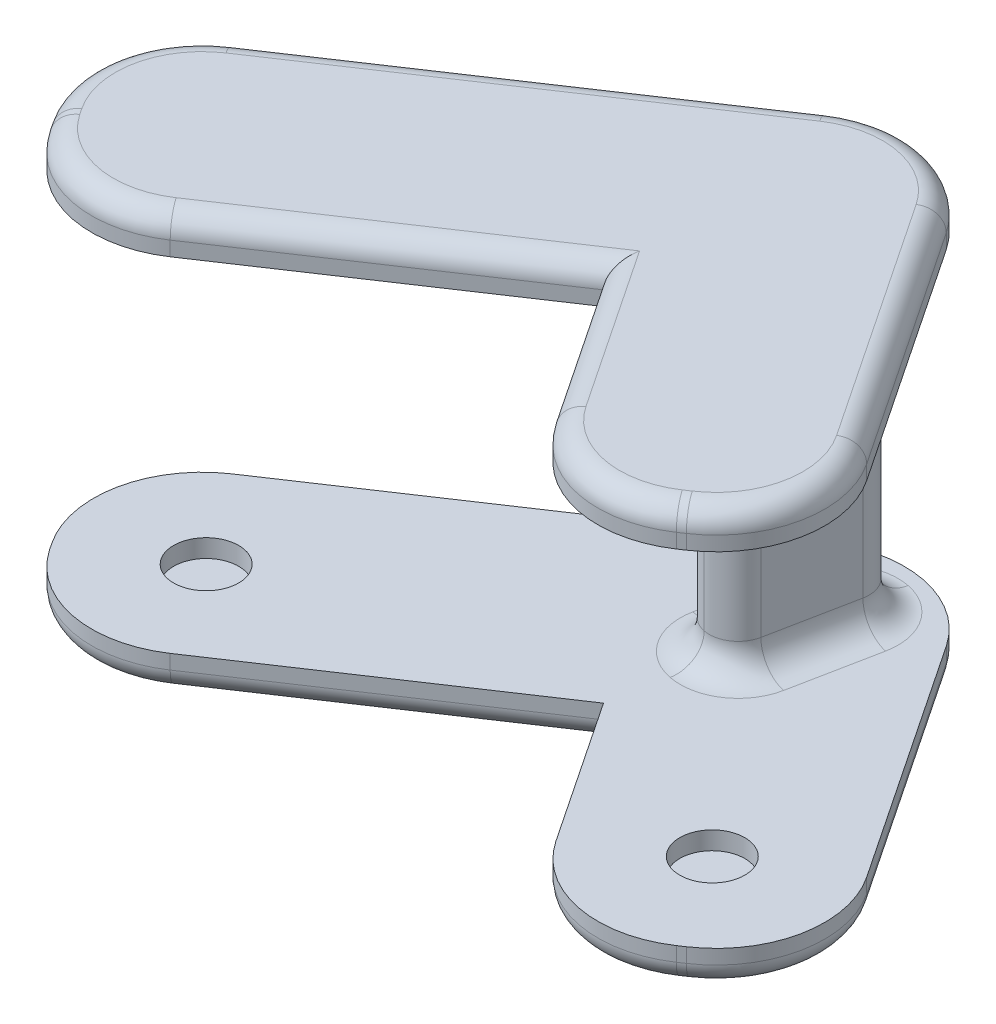
from build123d import *

# Parameters (mm, degrees)
SALIENTE_EXTRUIR2_DEPTH = 5
CROQUIS2_R              = 4.5
CORTAR_EXTRUIR1_DEPTH   = 2.5
SALIENTE_EXTRUIR3_DEPTH = 47.5
SALIENTE_EXTRUIR4_DEPTH = 5
CROQUIS6_R              = 10.5
CORTAR_EXTRUIR2_DEPTH   = 2.5
CROQUIS7_W              = 26.576799325
CROQUIS7_H              = 47.5
CROQUIS7_W_2            = 20
CORTAR_EXTRUIR3_DEPTH   = 12.5
REDONDEO1_R             = 15
REDONDEO2_R             = 3
REDONDEO3_R             = 4


with BuildPart() as part:
    # Croquis1 → Saliente-Extruir2 (new body)
    with BuildSketch(Plane(origin=(0, 0, 0), x_dir=(1, 0, 0), z_dir=(0, 1, 0))):
        Polygon((-4.276899691, -21.499026234), (-21.499026234, 4.276899691), (40.72350463, 45.850742798), (52.672201475, 53.834237539), (91.499026234, -4.276899691), (65.723100309, -21.499026234), (44.118402092, 10.836185071), align=None)
    extrude(amount=SALIENTE_EXTRUIR2_DEPTH)

    # Croquis2 → Cortar-Extruir1 (cut)
    with BuildSketch(Plane(origin=(0, 5, 0), x_dir=(1, 0, 0), z_dir=(0, 1, 0))):
        with Locations(Location((0, 0, 0), (0, 0, 270))):
            Circle(CROQUIS2_R)
        with Locations(Location((70, 0, 0), (0, 0, 270))):
            Circle(CROQUIS2_R)
    extrude(amount=-CORTAR_EXTRUIR1_DEPTH, mode=Mode.SUBTRACT)

    # Croquis4 → Saliente-Extruir3 (add)
    with BuildSketch(Plane(origin=(0, 5, 0), x_dir=(1, 0, 0), z_dir=(0, 1, 0))):
        Polygon((52.672201475, 53.834237539), (47.968631923, 50.691558194), (39.41483254, 7.693505725), (44.118402092, 10.836185071), (47.261081438, 6.132615519), (55.814880821, 49.130667987), align=None)
    extrude(amount=SALIENTE_EXTRUIR3_DEPTH)

    # Croquis5 → Saliente-Extruir4 (add)
    with BuildSketch(Plane(origin=(0, 52.5, 0), x_dir=(1, 0, 0), z_dir=(0, 1, 0))):
        Polygon((-21.499026234, 4.276899691), (-4.276899691, -21.499026234), (44.118402092, 10.836185071), (65.723100309, -21.499026234), (91.499026234, -4.276899691), (52.672201475, 53.834237539), align=None)
    extrude(amount=SALIENTE_EXTRUIR4_DEPTH)

    # Croquis6 → Cortar-Extruir2 (cut)
    with BuildSketch(Plane.XZ.offset(-52.5)):
        with Locations(Location((0, 0, 0), (0, 0, 270))):
            Circle(CROQUIS6_R)
        with Locations(Location((70, 0, 0), (0, 0, 270))):
            Circle(CROQUIS6_R)
    extrude(amount=-CORTAR_EXTRUIR2_DEPTH, mode=Mode.SUBTRACT)

    # Croquis7 → Cortar-Extruir3 (cut)
    with BuildSketch(Plane(origin=(36.442132095, 0, 7.249600136), x_dir=(-0.19511127576179904, 0, 0.9807811122113861), z_dir=(-0.9807811122113861, 0, -0.19511127576179904))):
        with Locations((-64.364943459, 28.75)):
            Rectangle(CROQUIS7_W, CROQUIS7_H)
        with Locations((-21.076543796, 28.75)):
            Rectangle(CROQUIS7_W_2, CROQUIS7_H)
    extrude(amount=-CORTAR_EXTRUIR3_DEPTH, mode=Mode.SUBTRACT)

    # Redondeo1
    redondeo1_edges = [part.edges().sort_by_distance(p)[0] for p in [
        (-4.276899691, 2.5, 21.499026234),
        (-21.499026234, 2.5, -4.276899691),
        (52.672201475, 55, -53.834237539),
        (91.499026234, 2.5, 4.276899691),
        (65.723100309, 2.5, 21.499026234),
        (-21.499026234, 55, -4.276899691),
        (-4.276899691, 55, 21.499026234),
        (65.723100309, 55, 21.499026234),
        (91.499026234, 55, 4.276899691),
        (52.672201475, 2.5, -53.834237539),
    ]]
    fillet(redondeo1_edges, radius=REDONDEO1_R)

    # Redondeo2
    redondeo2_edges = [part.edges().sort_by_distance(p)[0] for p in [
        (50.754107682, 0, -0.904690529),
        (15.58658762, 0, -29.055568615),
        (26.156862311, 0, 1.164777064),
        (-12.887962963, 0, 8.611063271),
        (72.085613855, 0, -24.778668924),
        (78.611063271, 0, 12.887962963),
        (85.405233658, 0, 3.064633643),
        (66.935366357, 0, 15.405233658),
        (-3.064633643, 0, 15.405233658),
        (-15.405233658, 0, -3.064633643),
        (51.459935426, 0, -47.740444963),
        (15.58658762, 57.5, -29.055568615),
        (72.085613855, 57.5, -24.778668924),
        (-12.887962963, 57.5, 8.611063271),
        (26.156862311, 57.5, 1.164777064),
        (78.611063271, 57.5, 12.887962963),
        (-15.405233658, 57.5, -3.064633643),
        (-3.064633643, 57.5, 15.405233658),
        (66.935366357, 57.5, 15.405233658),
        (85.405233658, 57.5, 3.064633643),
        (51.459935426, 57.5, -47.740444963),
        (50.754107682, 57.5, -0.904690529),
    ]]
    fillet(redondeo2_edges, radius=REDONDEO2_R)

    # Redondeo3
    redondeo3_edges = [part.edges().sort_by_distance(p)[0] for p in [
        (46.42864065, 52.5, -22.449241949),
        (42.505516202, 28.75, -23.229687052),
        (50.351765099, 28.75, -21.668796846),
        (46.42864065, 5, -22.449241949),
        (52.302877857, 52.5, -31.476607968),
        (44.456628959, 52.5, -33.037498174),
        (52.302877857, 5, -31.476607968),
        (44.456628959, 5, -33.037498174),
        (50.330866166, 5, -42.064864193),
        (46.407741717, 28.75, -42.845309296),
        (54.253990614, 28.75, -41.28441909),
        (50.330866166, 52.5, -42.064864193),
    ]]
    fillet(redondeo3_edges, radius=REDONDEO3_R - 0.0001)  # a hair under: the kernel refuses the full size


solid = part.part
